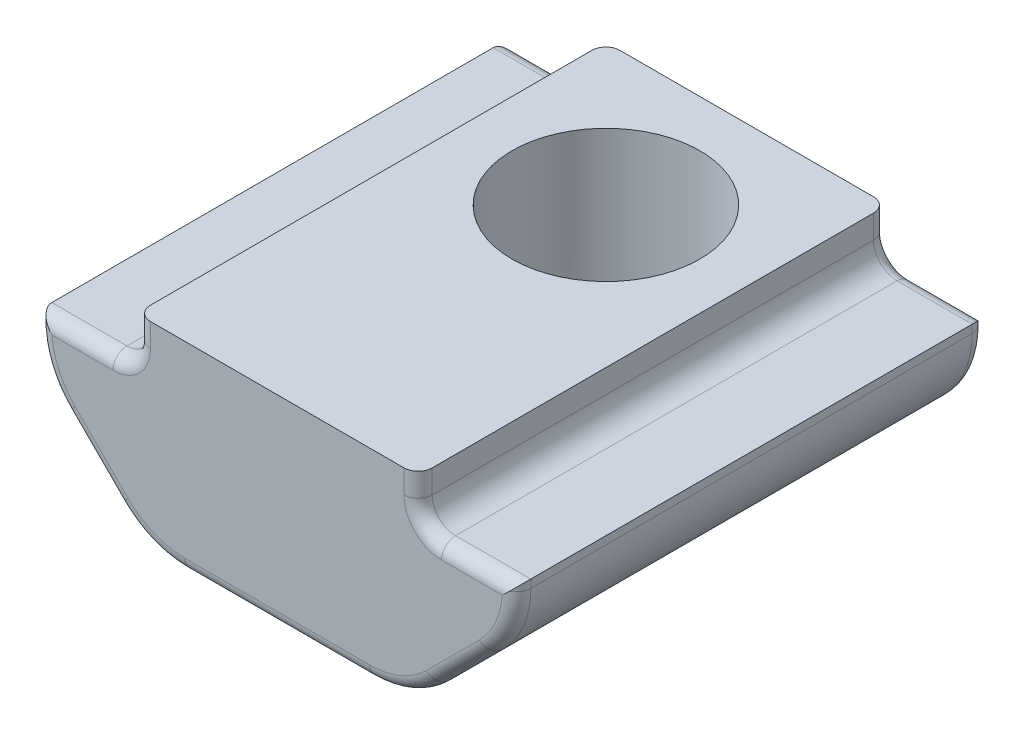
from build123d import *

# Parameters (mm, degrees)
EXTRUDE_1_DEPTH     = 10
FILLET_3_R          = 0.3
SKETCH_2_R          = 2
CUT_EXTRUDE_1_DEPTH = 6


with BuildPart() as part:
    # 草图1 → 凸台-拉伸1 (new body)
    with BuildSketch(Plane.XY):
        with BuildLine():
            Line((-3, 4.3), (3, 4.3))
            Line((3, 4.3), (3, 3.8))
            ThreePointArc((3, 3.8), (3.146446609, 3.446446609), (3.5, 3.3))
            Line((3.5, 3.3), (5.1, 3.3))
            Line((5.1, 3.3), (5.1, 3.128427125))
            ThreePointArc((5.1, 3.128427125), (4.947759065, 2.36306026), (4.514213562, 1.714213562))
            Line((4.514213562, 1.714213562), (3.385786438, 0.585786438))
            ThreePointArc((3.385786438, 0.585786438), (2.73693974, 0.152240935), (1.971572875, 0))
            Line((1.971572875, 0), (-1.971572875, 0))
            ThreePointArc((-1.971572875, 0), (-2.73693974, 0.152240935), (-3.385786438, 0.585786438))
            Line((-3.385786438, 0.585786438), (-4.514213562, 1.714213562))
            ThreePointArc((-4.514213562, 1.714213562), (-4.947759065, 2.36306026), (-5.1, 3.128427125))
            Line((-5.1, 3.128427125), (-5.1, 3.3))
            Line((-5.1, 3.3), (-3.5, 3.3))
            ThreePointArc((-3.5, 3.3), (-3.146446609, 3.446446609), (-3, 3.8))
            Line((-3, 3.8), (-3, 4.3))
        make_face()
    extrude(amount=EXTRUDE_1_DEPTH)

    # 圆角3
    # the kernel refuses this fillet: 0.3 mm, written as the material it takes off along each edge
    with BuildSketch(Plane(origin=(-3, 3.8, 10), x_dir=(0, 0, -1), z_dir=(0, 1, 0)), Plane(origin=(3, 5.05, 10), x_dir=(0, 0, -1), z_dir=(0, -1, 0))) as fillet_3_piece_1:
        with BuildLine():
            CenterArc((FILLET_3_R, -FILLET_3_R), FILLET_3_R, 90, 90)
            Line((0, -FILLET_3_R), (0, 0))
            Line((0, 0), (FILLET_3_R, 0))
        make_face()
    extrude(amount=1.25, mode=Mode.SUBTRACT)
    with BuildSketch(Plane(origin=(3, 5.05, 0), x_dir=(0, 0, 1), z_dir=(0, -1, 0)), Plane(origin=(-3, 3.8, 0), x_dir=(0, 0, 1), z_dir=(0, 1, 0))) as fillet_3_piece_2:
        with BuildLine():
            CenterArc((FILLET_3_R, FILLET_3_R), FILLET_3_R, 180, 90)
            Line((0, FILLET_3_R), (0, 0))
            Line((0, 0), (FILLET_3_R, 0))
        make_face()
    extrude(amount=1.25, mode=Mode.SUBTRACT)
    with BuildSketch(Plane(origin=(4.514213562, 1.714213562, 10), x_dir=(0, 0, -1), z_dir=(-0.7071067811865436, -0.7071067811865515, 0)), Plane(origin=(-3.385786438, 0.585786438, 10), x_dir=(0, 0, -1), z_dir=(-0.7071067811865436, 0.7071067811865515, 0))) as fillet_3_piece_3:
        with BuildLine():
            CenterArc((FILLET_3_R, -FILLET_3_R), FILLET_3_R, 90, 90)
            Line((0, -FILLET_3_R), (0, 0))
            Line((0, 0), (FILLET_3_R, 0))
        make_face()
    extrude(amount=1.595836944, mode=Mode.SUBTRACT)
    with BuildSketch(Plane(origin=(1.971572875, 2, 10), x_dir=(0.7071067811865542, -0.7071067811865409, 0), z_dir=(0.7071067811865409, 0.7071067811865542, 0))) as fillet_3_piece_4:
        with BuildLine():
            CenterArc((2 - FILLET_3_R, FILLET_3_R), FILLET_3_R, 270, 90)
            Line((2 - FILLET_3_R, 0), (2, 0))
            Line((2, 0), (2, FILLET_3_R))
        make_face()
    revolve(axis=Axis((1.971572875, 2, 10), (0, 0, -1)), revolution_arc=45, mode=Mode.SUBTRACT)
    with BuildSketch(Plane(origin=(1.971572875, 0, 10), x_dir=(0, 0, -1), z_dir=(-1, 0, 0))) as fillet_3_piece_5:
        with BuildLine():
            CenterArc((FILLET_3_R, -FILLET_3_R), FILLET_3_R, 90, 90)
            Line((0, -FILLET_3_R), (0, 0))
            Line((0, 0), (FILLET_3_R, 0))
        make_face()
    extrude(amount=3.943145751, mode=Mode.SUBTRACT)
    with BuildSketch(Plane(origin=(-1.971572875, 2, 10), x_dir=(0, -1, 0), z_dir=(1, 0, 0))) as fillet_3_piece_6:
        with BuildLine():
            CenterArc((2 - FILLET_3_R, FILLET_3_R), FILLET_3_R, 270, 90)
            Line((2 - FILLET_3_R, 0), (2, 0))
            Line((2, 0), (2, FILLET_3_R))
        make_face()
    revolve(axis=Axis((-1.971572875, 2, 10), (0, 0, -1)), revolution_arc=45, mode=Mode.SUBTRACT)
    with BuildSketch(Plane(origin=(-3.1, 3.128427125, 10), x_dir=(-0.7071067811865485, -0.7071067811865466, 0), z_dir=(0.7071067811865466, -0.7071067811865485, 0))) as fillet_3_piece_7:
        with BuildLine():
            CenterArc((2 - FILLET_3_R, FILLET_3_R), FILLET_3_R, 270, 90)
            Line((2 - FILLET_3_R, 0), (2, 0))
            Line((2, 0), (2, FILLET_3_R))
        make_face()
    revolve(axis=Axis((-3.1, 3.128427125, 10), (0, 0, -1)), revolution_arc=45, mode=Mode.SUBTRACT)
    with BuildSketch(Plane(origin=(-5.85, 3.3, 10), x_dir=(0, 0, -1), z_dir=(1, 0, 0)), Plane(origin=(3.5, 3.3, 10), x_dir=(0, 0, -1), z_dir=(1, 0, 0))) as fillet_3_piece_8:
        with BuildLine():
            CenterArc((FILLET_3_R, -FILLET_3_R), FILLET_3_R, 90, 90)
            Line((0, -FILLET_3_R), (0, 0))
            Line((0, 0), (FILLET_3_R, 0))
        make_face()
    extrude(amount=2.35, mode=Mode.SUBTRACT)
    with BuildSketch(Plane(origin=(-3.5, 3.8, 10), x_dir=(0, -1, 0), z_dir=(-1, 0, 0))) as fillet_3_piece_9:
        with BuildLine():
            CenterArc((0.5 + FILLET_3_R, -FILLET_3_R), FILLET_3_R, 90, 90)
            Line((0.5 + FILLET_3_R, 0), (0.5, 0))
            Line((0.5, 0), (0.5, -FILLET_3_R))
        make_face()
    revolve(axis=Axis((-3.5, 3.8, 10), (0, 0, 1)), revolution_arc=90, mode=Mode.SUBTRACT)
    with BuildSketch(Plane(origin=(3.5, 3.3, 0), x_dir=(0, 0, 1), z_dir=(1, 0, 0)), Plane(origin=(-5.85, 3.3, 0), x_dir=(0, 0, 1), z_dir=(1, 0, 0))) as fillet_3_piece_10:
        with BuildLine():
            CenterArc((FILLET_3_R, FILLET_3_R), FILLET_3_R, 180, 90)
            Line((0, FILLET_3_R), (0, 0))
            Line((0, 0), (FILLET_3_R, 0))
        make_face()
    extrude(amount=2.35, mode=Mode.SUBTRACT)
    with BuildSketch(Plane(origin=(3.5, 3.8, 0), x_dir=(-1, 0, 0), z_dir=(0, 1, 0))) as fillet_3_piece_11:
        with BuildLine():
            CenterArc((0.5 + FILLET_3_R, FILLET_3_R), FILLET_3_R, 180, 90)
            Line((0.5 + FILLET_3_R, 0), (0.5, 0))
            Line((0.5, 0), (0.5, FILLET_3_R))
        make_face()
    revolve(axis=Axis((3.5, 3.8, 0), (0, 0, 1)), revolution_arc=90, mode=Mode.SUBTRACT)
    with BuildSketch(Plane(origin=(-3.385786438, 0.585786438, 0), x_dir=(0, 0, 1), z_dir=(-0.7071067811865436, 0.7071067811865515, 0)), Plane(origin=(4.514213562, 1.714213562, 0), x_dir=(0, 0, 1), z_dir=(-0.7071067811865436, -0.7071067811865515, 0))) as fillet_3_piece_12:
        with BuildLine():
            CenterArc((FILLET_3_R, FILLET_3_R), FILLET_3_R, 180, 90)
            Line((0, FILLET_3_R), (0, 0))
            Line((0, 0), (FILLET_3_R, 0))
        make_face()
    extrude(amount=1.595836944, mode=Mode.SUBTRACT)
    with BuildSketch(Plane(origin=(-1.971572875, 2, 0), x_dir=(0, -1, 0), z_dir=(1, 0, 0))) as fillet_3_piece_13:
        with BuildLine():
            CenterArc((2 - FILLET_3_R, -FILLET_3_R), FILLET_3_R, 0, 90)
            Line((2 - FILLET_3_R, 0), (2, 0))
            Line((2, 0), (2, -FILLET_3_R))
        make_face()
    revolve(axis=Axis((-1.971572875, 2, 0), (0, 0, -1)), revolution_arc=45, mode=Mode.SUBTRACT)
    with BuildSketch(Plane(origin=(1.971572875, 0, 0), x_dir=(0, 0, 1), z_dir=(-1, 0, 0))) as fillet_3_piece_14:
        with BuildLine():
            CenterArc((FILLET_3_R, FILLET_3_R), FILLET_3_R, 180, 90)
            Line((0, FILLET_3_R), (0, 0))
            Line((0, 0), (FILLET_3_R, 0))
        make_face()
    extrude(amount=3.943145751, mode=Mode.SUBTRACT)
    with BuildSketch(Plane(origin=(1.971572875, 2, 0), x_dir=(0.7071067811865542, -0.7071067811865409, 0), z_dir=(0.7071067811865409, 0.7071067811865542, 0))) as fillet_3_piece_15:
        with BuildLine():
            CenterArc((2 - FILLET_3_R, -FILLET_3_R), FILLET_3_R, 0, 90)
            Line((2 - FILLET_3_R, 0), (2, 0))
            Line((2, 0), (2, -FILLET_3_R))
        make_face()
    revolve(axis=Axis((1.971572875, 2, 0), (0, 0, -1)), revolution_arc=45, mode=Mode.SUBTRACT)
    with BuildSketch(Plane(origin=(3.1, 3.128427125, 0), x_dir=(1, 0, 0), z_dir=(0, 1, 0))) as fillet_3_piece_16:
        with BuildLine():
            CenterArc((2 - FILLET_3_R, -FILLET_3_R), FILLET_3_R, 0, 90)
            Line((2 - FILLET_3_R, 0), (2, 0))
            Line((2, 0), (2, -FILLET_3_R))
        make_face()
    revolve(axis=Axis((3.1, 3.128427125, 0), (0, 0, -1)), revolution_arc=45, mode=Mode.SUBTRACT)
    with BuildSketch(Plane(origin=(3.1, 3.128427125, 10), x_dir=(1, 0, 0), z_dir=(0, 1, 0))) as fillet_3_piece_17:
        with BuildLine():
            CenterArc((2 - FILLET_3_R, FILLET_3_R), FILLET_3_R, 270, 90)
            Line((2 - FILLET_3_R, 0), (2, 0))
            Line((2, 0), (2, FILLET_3_R))
        make_face()
    revolve(axis=Axis((3.1, 3.128427125, 10), (0, 0, -1)), revolution_arc=45, mode=Mode.SUBTRACT)
    with BuildSketch(Plane(origin=(-3.1, 3.128427125, 0), x_dir=(-0.7071067811865485, -0.7071067811865466, 0), z_dir=(0.7071067811865466, -0.7071067811865485, 0))) as fillet_3_piece_18:
        with BuildLine():
            CenterArc((2 - FILLET_3_R, -FILLET_3_R), FILLET_3_R, 0, 90)
            Line((2 - FILLET_3_R, 0), (2, 0))
            Line((2, 0), (2, -FILLET_3_R))
        make_face()
    revolve(axis=Axis((-3.1, 3.128427125, 0), (0, 0, -1)), revolution_arc=45, mode=Mode.SUBTRACT)
    with BuildSketch(Plane(origin=(3.5, 3.8, 10), x_dir=(-1, 0, 0), z_dir=(0, 1, 0))) as fillet_3_piece_19:
        with BuildLine():
            CenterArc((0.5 + FILLET_3_R, -FILLET_3_R), FILLET_3_R, 90, 90)
            Line((0.5 + FILLET_3_R, 0), (0.5, 0))
            Line((0.5, 0), (0.5, -FILLET_3_R))
        make_face()
    revolve(axis=Axis((3.5, 3.8, 10), (0, 0, 1)), revolution_arc=90, mode=Mode.SUBTRACT)
    with BuildSketch(Plane(origin=(-3.5, 3.8, 0), x_dir=(0, -1, 0), z_dir=(-1, 0, 0))) as fillet_3_piece_20:
        with BuildLine():
            CenterArc((0.5 + FILLET_3_R, FILLET_3_R), FILLET_3_R, 180, 90)
            Line((0.5 + FILLET_3_R, 0), (0.5, 0))
            Line((0.5, 0), (0.5, FILLET_3_R))
        make_face()
    revolve(axis=Axis((-3.5, 3.8, 0), (0, 0, 1)), revolution_arc=90, mode=Mode.SUBTRACT)
    with BuildSketch(Plane(origin=(-5.1, 3.128427125, 0), x_dir=(0, 0, 1), z_dir=(0, 1, 0)), Plane(origin=(5.1, 4.05, 0), x_dir=(0, 0, 1), z_dir=(0, -1, 0))) as fillet_3_piece_21:
        with BuildLine():
            CenterArc((FILLET_3_R, FILLET_3_R), FILLET_3_R, 180, 90)
            Line((0, FILLET_3_R), (0, 0))
            Line((0, 0), (FILLET_3_R, 0))
        make_face()
    extrude(amount=0.921572875, mode=Mode.SUBTRACT)
    with BuildSketch(Plane(origin=(5.1, 4.05, 10), x_dir=(0, 0, -1), z_dir=(0, -1, 0)), Plane(origin=(-5.1, 3.128427125, 10), x_dir=(0, 0, -1), z_dir=(0, 1, 0))) as fillet_3_piece_22:
        with BuildLine():
            CenterArc((FILLET_3_R, -FILLET_3_R), FILLET_3_R, 90, 90)
            Line((0, -FILLET_3_R), (0, 0))
            Line((0, 0), (FILLET_3_R, 0))
        make_face()
    extrude(amount=0.921572875, mode=Mode.SUBTRACT)

    # 草图2 → 切除-拉伸1 (cut)
    with BuildSketch(Plane(origin=(0, 4.3, 0), x_dir=(1, 0, 0), z_dir=(0, 1, 0))):
        with Locations(Location((0, -3, 0), (0, 0, 270))):
            Circle(SKETCH_2_R)
    extrude(amount=-CUT_EXTRUDE_1_DEPTH, mode=Mode.SUBTRACT)


solid = part.part
